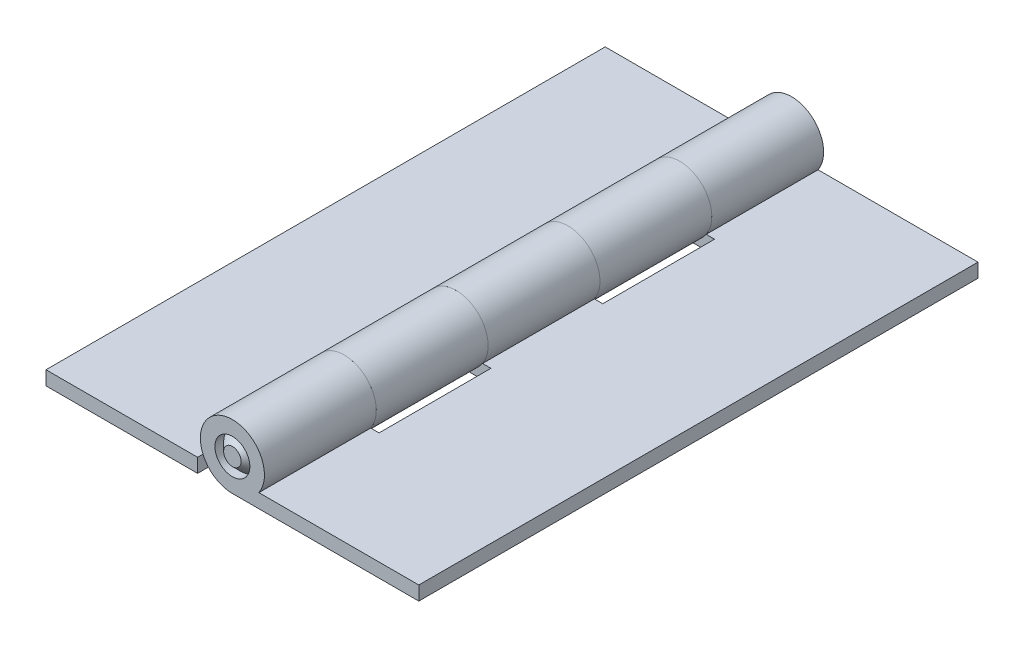
from build123d import *

# Parameters (mm, degrees)
SKETCH1_R            = 2.38125
EXTRUDE1_DEPTH       = 38.1
SKETCH1_W            = 20.653375
SKETCH1_H            = 1.905
EXTRUDE1_2_DEPTH     = 38.1
SKETCH3_W            = 9.49325
SKETCH3_H            = 15.24
CUT_EXTRUDE1_DEPTH   = 38.1
SKETCH4_R            = 2.38125
EXTRUDE2_DEPTH       = 15.24
SKETCH5_R            = 2.38125
EXTRUDE3_DEPTH       = 15.24
EXTRUDE23_DEPTH      = 48.427977944
EXTRUDE23_DEPTH_BACK = 48.427977944
SKETCH19_W           = 50.8
SKETCH19_H           = 1.7145
CHAMFER1_SIZE        = 1.190625


with BuildPart() as part:
    # Sketch1 → Extrude1 (new, symmetric)
    with BuildSketch(Plane.XY):
        with BuildLine():
            Line((25.4, -4.365625), (0, -4.365625))
            ThreePointArc((0, -4.365625), (-2.039180672, 3.860106712), (3.6061068, -2.460625))
            Line((3.6061068, -2.460625), (25.4, -2.460625))
            Line((25.4, -2.460625), (25.4, -4.365625))
        make_face()
        with Locations(Location((0, 0, 0), (0, 0, 180))):
            Circle(SKETCH1_R, mode=Mode.SUBTRACT)
    extrude(amount=EXTRUDE1_DEPTH, both=True)

    # Sketch3 → Cut-Extrude1 (cut, symmetric)
    with BuildSketch(Plane(origin=(0, 0, 0), x_dir=(1, 0, 0), z_dir=(0, 1, 0))):
        with Locations((0, 15.24)):
            Rectangle(SKETCH3_W, SKETCH3_H)
        with Locations((0, -15.24)):
            Rectangle(SKETCH3_W, SKETCH3_H)
    extrude(amount=CUT_EXTRUDE1_DEPTH, both=True, mode=Mode.SUBTRACT)


with BuildPart() as body_2:
    # Sketch1 → Extrude1 2 (new, symmetric)
    with BuildSketch(Plane.XY):
        with Locations((-15.0733125, -3.413125)):
            Rectangle(SKETCH1_W, SKETCH1_H)
    extrude(amount=EXTRUDE1_2_DEPTH, both=True)

    # Sketch4 → Extrude2 (add)
    with BuildSketch(Plane.XY.offset(-22.86)):
        with BuildLine():
            Line((-4.746625, -2.460625), (-3.6061068, -2.460625))
            ThreePointArc((-3.6061068, -2.460625), (2.039180672, 3.860106712), (0, -4.365625))
            Line((0, -4.365625), (-4.746625, -4.365625))
            Line((-4.746625, -4.365625), (-4.746625, -2.460625))
        make_face()
        with Locations(Location((0, 0, 0), (0, 0, 180))):
            Circle(SKETCH4_R, mode=Mode.SUBTRACT)
    extrude(amount=EXTRUDE2_DEPTH)

    # Sketch5 → Extrude3 (add)
    with BuildSketch(Plane.XY.offset(7.62)):
        with BuildLine():
            Line((-3.6061068, -2.460625), (-4.746625, -2.460625))
            Line((-4.746625, -2.460625), (-4.746625, -4.365625))
            Line((-4.746625, -4.365625), (0, -4.365625))
            ThreePointArc((0, -4.365625), (2.039180672, 3.860106712), (-3.6061068, -2.460625))
        make_face()
        with Locations(Location((0, 0, 0), (0, 0, 180))):
            Circle(SKETCH5_R, mode=Mode.SUBTRACT)
    extrude(amount=EXTRUDE3_DEPTH)


with BuildPart() as body_3:
    # Sketch6 → Revolve1 (revolve)
    with BuildSketch(Plane(origin=(0, 0, 0), x_dir=(1, 0, 0), z_dir=(0, 1, 0)), mode=Mode.PRIVATE) as revolve1_sk:
        with BuildLine():
            Line((-3.3734375, 38.1), (-2.38125, 38.1))
            Line((-2.38125, 38.1), (-2.38125, -38.1))
            Line((-2.38125, -38.1), (-3.3734375, -38.1))
            ThreePointArc((-3.3734375, -38.1), (-1.89206176, -39.361281386), (0, -39.8145))
            Line((0, -39.8145), (0, 39.8145))
            ThreePointArc((0, 39.8145), (-1.89206176, 39.361281386), (-3.3734375, 38.1))
        make_face()
    revolve(revolve1_sk.sketch.rotate(Axis((0, 0, -39.8145), (0, 0, 1)), 180), axis=Axis((0, 0, -39.8145), (0, 0, 1)))

    # Sketch19 → Extrude23 (cut, two sides: drawn at the far end of the back side and taken through both)
    with BuildSketch(Plane(origin=(0, 0, 0), x_dir=(1, 0, 0), z_dir=(0, 1, 0)).offset(-EXTRUDE23_DEPTH_BACK)):
        with Locations((0, -38.95725)):
            Rectangle(SKETCH19_W, SKETCH19_H)
    extrude(amount=EXTRUDE23_DEPTH + EXTRUDE23_DEPTH_BACK, mode=Mode.SUBTRACT)

    # Chamfer1
    chamfer1_edges = [body_3.edges().sort_by_distance(p)[0] for p in [
        (-2.38125, 0, 38.1),
    ]]
    chamfer(chamfer1_edges, length=CHAMFER1_SIZE)


solid = Compound([part.part, body_2.part, body_3.part])
